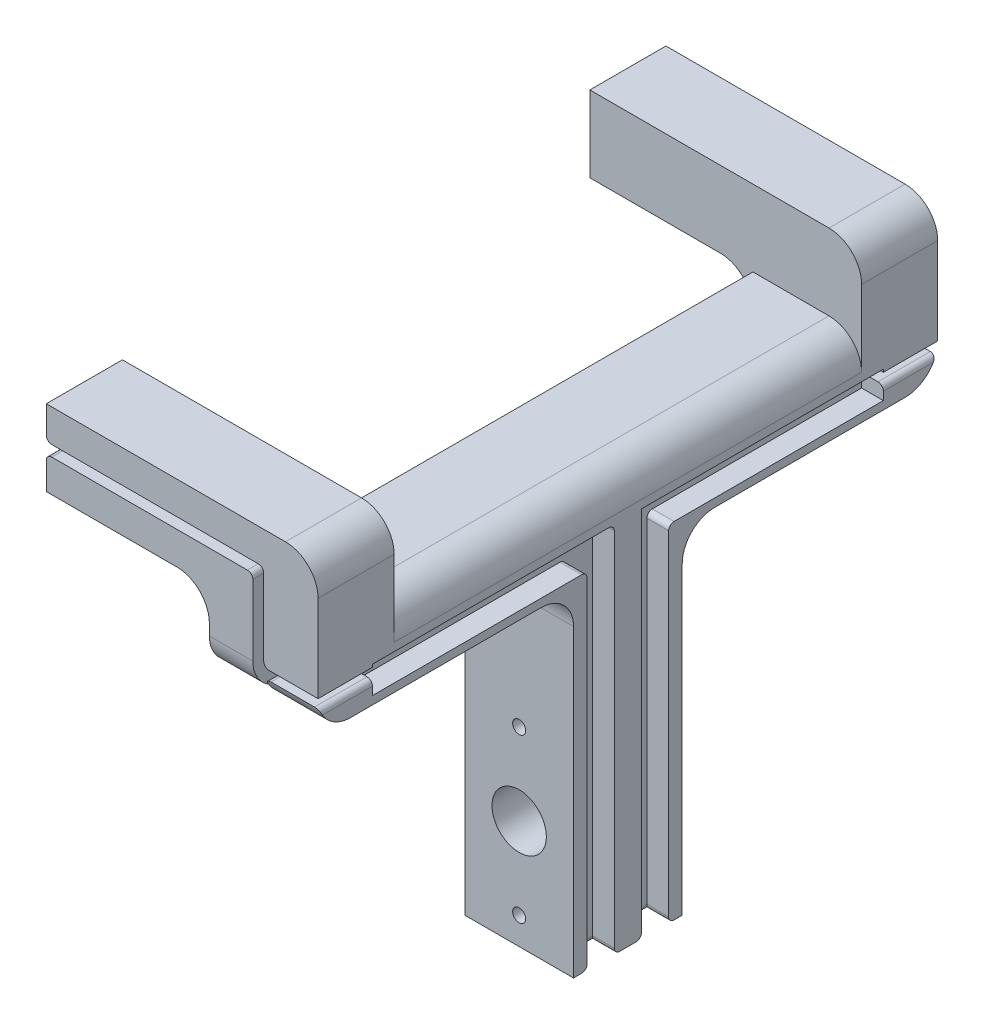
from build123d import *

# Parameters (mm, degrees)
ESQUISSE1_W             = 10
ESQUISSE1_H             = 38
ESQUISSE1_R             = 2.5
ESQUISSE1_R_2           = 0.5
BOSS_EXTRU_1_DEPTH      = 10
BOSS_EXTRU_2_DEPTH      = 10
ESQUISSE5_W             = 7
ESQUISSE5_H             = 7
BOSS_EXTRU_3_DEPTH      = 15
CONG_1_R                = 3
D_GAGEMENT_M11_D        = 1.2
ENL_V_MAT_EXTRU_2_DEPTH = 5
ENL_V_MAT_EXTRU_3_DEPTH = 2
CONG_2_R                = 0.5


with BuildPart() as part:
    # Esquisse1 → Boss.-Extru.1 (new body)
    with BuildSketch(Plane.XY):
        with Locations((9, 19)):
            Rectangle(ESQUISSE1_W, ESQUISSE1_H)
        with Locations((9, 10)):
            Circle(ESQUISSE1_R, mode=Mode.SUBTRACT)
        with Locations((9, 17.5)):
            Circle(ESQUISSE1_R_2, mode=Mode.SUBTRACT)
        with Locations((9, 2.5)):
            Circle(ESQUISSE1_R_2, mode=Mode.SUBTRACT)
    extrude(amount=BOSS_EXTRU_1_DEPTH)

    # Esquisse4 → Boss.-Extru.2 (add)
    with BuildSketch(Plane(origin=(14, 0, 0), x_dir=(0, 0, -1), z_dir=(1, 0, 0))):
        Polygon((-26.5, 38), (16.5, 38), (16.5, 45), (23.5, 45), (23.5, 31), (-33.5, 31), (-33.5, 45), (-26.5, 45), align=None)
    extrude(amount=-BOSS_EXTRU_2_DEPTH)

    # Esquisse5 → Boss.-Extru.3 (add)
    with BuildSketch(Plane.ZY.offset(-4)):
        with Locations((-20, 41.5)):
            Rectangle(ESQUISSE5_W, ESQUISSE5_H)
        with Locations((30, 41.5)):
            Rectangle(ESQUISSE5_W, ESQUISSE5_H)
    extrude(amount=BOSS_EXTRU_3_DEPTH)

    # Congé1
    cong_1_edges = [part.edges().sort_by_distance(p)[0] for p in [
        (4, 38, -20),
        (4, 38, 30),
        (9, 31, -23.5),
        (9, 31, 33.5),
        (14, 45, -20),
        (14, 45, 30),
        (9, 31, 0),
        (9, 31, 10),
        (14, 38, 5),
    ]]
    fillet(cong_1_edges, radius=CONG_1_R)

    # Dégagement M11 (through all)
    with Locations(Plane.XY.offset(10)):
        with Locations((9, 17.5), (9, 2.5)):
            Hole(D_GAGEMENT_M11_D / 2)

    # Esquisse10 → Enlèv. mat.-Extru.2 (cut)
    with BuildSketch(Plane.XY.offset(33.5)):
        Polygon((-11, 41), (8, 41), (8, 31), (9, 31), (9, 33), (14, 33), (14, 34), (9, 34), (9, 42), (-11, 42), align=None)
    enl_v_mat_extru_2 = extrude(amount=-ENL_V_MAT_EXTRU_2_DEPTH, mode=Mode.SUBTRACT)

    # Esquisse11 → Enlèv. mat.-Extru.3 (cut)
    with BuildSketch(Plane(origin=(14, 0, 0), x_dir=(0, 0, -1), z_dir=(1, 0, 0))):
        Polygon((-28.5, 34.25), (-6.25, 34.25), (-6.25, 0), (-8.75, 0), (-8.75, 31.75), (-28.5, 31.75), align=None)
    enl_v_mat_extru_3 = extrude(amount=-ENL_V_MAT_EXTRU_3_DEPTH, mode=Mode.SUBTRACT)

    # Symétrie1: Enlèv. mat.-Extru.2, Enlèv. mat.-Extru.3 across plane
    add(enl_v_mat_extru_2.mirror(Plane.XY.offset(5)), mode=Mode.SUBTRACT)
    add(enl_v_mat_extru_3.mirror(Plane.XY.offset(5)), mode=Mode.SUBTRACT)

    # Congé2
    cong_2_edges = [part.edges().sort_by_distance(p)[0] for p in [
        (13, 0, 8.75),
        (12, 0, 7.5),
        (13, 0, 6.25),
        (13, 34.25, 6.25),
        (13, 31.75, 8.75),
        (-11, 41, 31),
        (-11, 42, 31),
        (14, 33, 30.914213562),
        (9, 34, 31),
        (9, 42, 31),
        (8, 41, 31),
        (-11, 41.5, 28.5),
        (-11, 41, -21),
        (-11, 41.5, -18.5),
        (-11, 42, -21),
        (9, 42, -21),
        (8, 41, -21),
        (9, 34, -21),
        (14, 33, -20.914213562),
        (13, 0, 1.25),
        (13, 0, 3.75),
        (12, 0, 2.5),
        (13, 31.75, 1.25),
        (9, 33, 30.914213562),
        (9, 33, -20.914213562),
    ]]
    fillet(cong_2_edges, radius=CONG_2_R)


solid = part.part
